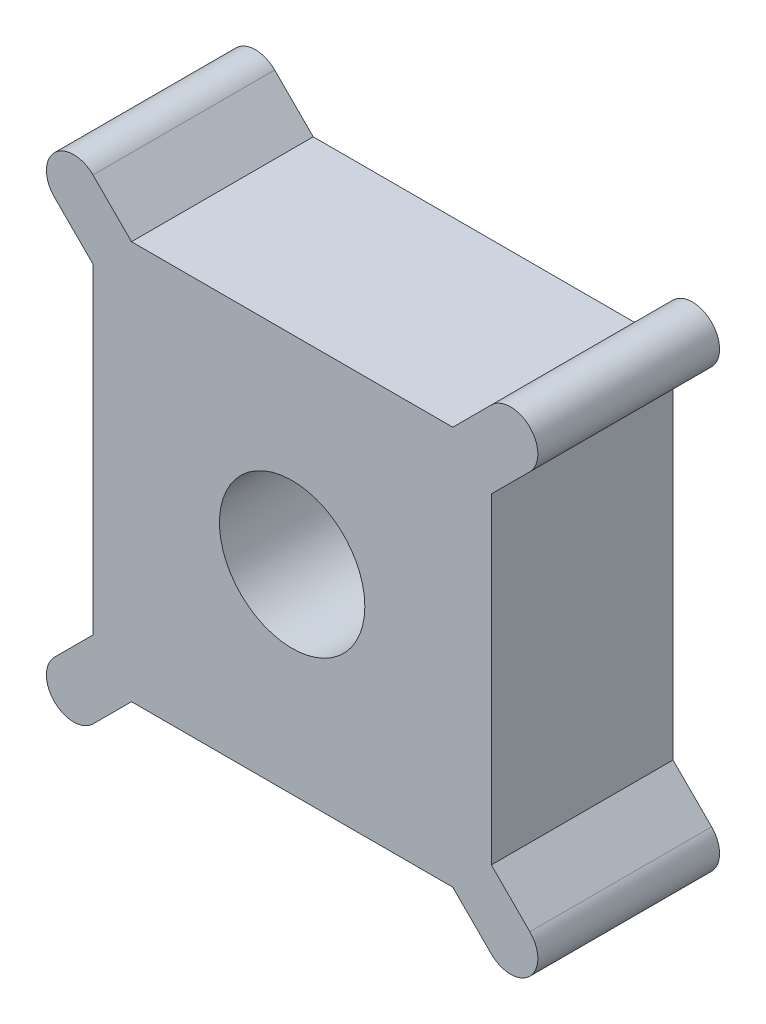
from build123d import *

# Parameters (mm, degrees)
BOSS_EXTRUDE1_DEPTH = 10
SKETCH4_R           = 4
CUT_EXTRUDE1_DEPTH  = 22.578343117


with BuildPart() as part:
    # Sketch3 → Boss-Extrude1 (new body)
    with BuildSketch(Plane.XY):
        with BuildLine():
            Line((-13.081475452, 10.960155108), (-10.960155108, 8.838834765))
            Line((-10.960155108, 8.838834765), (-10.960155108, -8.838834765))
            Line((-10.960155108, -8.838834765), (-13.081475452, -10.960155108))
            ThreePointArc((-13.081475452, -10.960155108), (-13.081475452, -13.081475452), (-10.960155108, -13.081475452))
            Line((-10.960155108, -13.081475452), (-8.838834765, -10.960155108))
            Line((-8.838834765, -10.960155108), (8.838834765, -10.960155108))
            Line((8.838834765, -10.960155108), (10.960155108, -13.081475452))
            ThreePointArc((10.960155108, -13.081475452), (13.081475452, -13.081475452), (13.081475452, -10.960155108))
            Line((13.081475452, -10.960155108), (10.960155108, -8.838834765))
            Line((10.960155108, -8.838834765), (10.960155108, 8.838834765))
            Line((10.960155108, 8.838834765), (13.081475452, 10.960155108))
            ThreePointArc((13.081475452, 10.960155108), (13.081475452, 13.081475452), (10.960155108, 13.081475452))
            Line((10.960155108, 13.081475452), (8.838834765, 10.960155108))
            Line((8.838834765, 10.960155108), (-8.838834765, 10.960155108))
            Line((-8.838834765, 10.960155108), (-10.960155108, 13.081475452))
            ThreePointArc((-10.960155108, 13.081475452), (-13.081475452, 13.081475452), (-13.081475452, 10.960155108))
        make_face()
    extrude(amount=-BOSS_EXTRUDE1_DEPTH)

    # Sketch4 → Cut-Extrude1 (cut, through all)
    with BuildSketch(Plane.XY):
        Circle(SKETCH4_R)
    extrude(amount=-CUT_EXTRUDE1_DEPTH, mode=Mode.SUBTRACT)


solid = part.part
